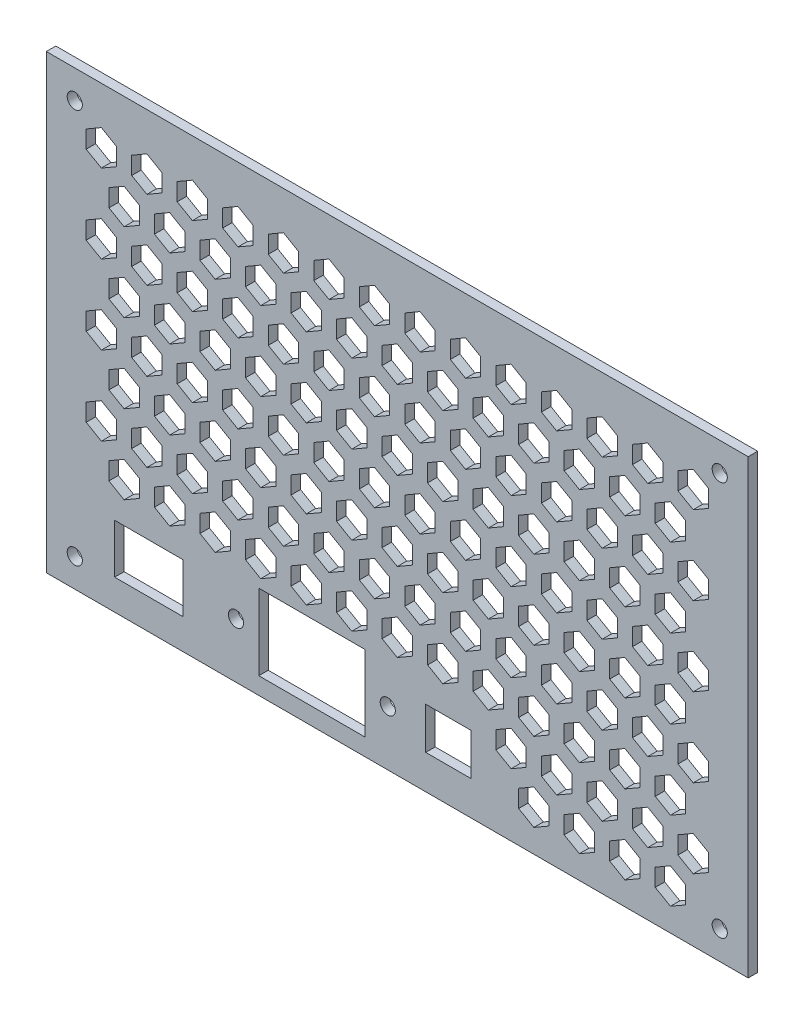
from build123d import *

# Parameters (mm, degrees)
SKETCH1_W               = 185
SKETCH1_H               = 115
BOSS_EXTRUDE1_DEPTH     = 2.5
SKETCH2_R               = 2
SKETCH2_W               = 18
SKETCH2_H               = 13
SKETCH2_W_2             = 28
SKETCH2_H_2             = 20
CUT_EXTRUDE1_DEPTH      = 10
CUT_EXTRUDE3_DEPTH      = 10
CUT_EXTRUDE4_DEPTH      = 109.943792848
CUT_EXTRUDE4_DEPTH_BACK = 109.943792848
SKETCH6_R               = 2
SKETCH8_W               = 12
SKETCH8_H               = 11
CUT_EXTRUDE5_DEPTH      = 10
SKETCH9_W               = 185
SKETCH9_H               = 4
BOSS_EXTRUDE2_DEPTH     = 2.5


with BuildPart() as part:
    # Sketch1 → Boss-Extrude1 (new body)
    with BuildSketch(Plane.XY):
        Rectangle(SKETCH1_W, SKETCH1_H)
    extrude(amount=BOSS_EXTRUDE1_DEPTH)

    # Sketch2 → Cut-Extrude1 (cut)
    with BuildSketch(Plane(origin=(0, 0, 0), x_dir=(-1, 0, 0), z_dir=(0, 0, -1))):
        with Locations((42.5, -43)):
            Circle(SKETCH2_R)
        with Locations((2.5, -43)):
            Circle(SKETCH2_R)
        with Locations((65.5, -43)):
            Rectangle(SKETCH2_W, SKETCH2_H)
        with Locations((22.5, -43)):
            Rectangle(SKETCH2_W_2, SKETCH2_H_2)
    extrude(amount=-CUT_EXTRUDE1_DEPTH, mode=Mode.SUBTRACT)

    # Sketch5 → Cut-Extrude3 (cut)
    with BuildSketch(Plane(origin=(0, 0, 0), x_dir=(-1, 0, 0), z_dir=(0, 0, -1))):
        Polygon((-72, 40.982695155), (-76, 38.673294078), (-76, 34.054491924), (-72, 31.745090848), (-68, 34.054491924), (-68, 38.673294078), align=None)
        Polygon((-78, 51.375), (-82, 49.065598923), (-82, 44.44679677), (-78, 42.137395693), (-74, 44.44679677), (-74, 49.065598923), align=None)
        Polygon((-60, 40.982695155), (-64, 38.673294078), (-64, 34.054491924), (-60, 31.745090848), (-56, 34.054491924), (-56, 38.673294078), align=None)
        Polygon((-66, 51.375), (-70, 49.065598923), (-70, 44.44679677), (-66, 42.137395693), (-62, 44.44679677), (-62, 49.065598923), align=None)
        Polygon((-48, 40.982695155), (-52, 38.673294078), (-52, 34.054491924), (-48, 31.745090848), (-44, 34.054491924), (-44, 38.673294078), align=None)
        Polygon((-54, 51.375), (-58, 49.065598923), (-58, 44.44679677), (-54, 42.137395693), (-50, 44.44679677), (-50, 49.065598923), align=None)
        Polygon((-36, 40.982695155), (-40, 38.673294078), (-40, 34.054491924), (-36, 31.745090848), (-32, 34.054491924), (-32, 38.673294078), align=None)
        Polygon((-42, 51.375), (-46, 49.065598923), (-46, 44.44679677), (-42, 42.137395693), (-38, 44.44679677), (-38, 49.065598923), align=None)
        Polygon((-24, 40.982695155), (-28, 38.673294078), (-28, 34.054491924), (-24, 31.745090848), (-20, 34.054491924), (-20, 38.673294078), align=None)
        Polygon((-30, 51.375), (-34, 49.065598923), (-34, 44.44679677), (-30, 42.137395693), (-26, 44.44679677), (-26, 49.065598923), align=None)
        Polygon((-12, 40.982695155), (-16, 38.673294078), (-16, 34.054491924), (-12, 31.745090848), (-8, 34.054491924), (-8, 38.673294078), align=None)
        Polygon((-18, 51.375), (-22, 49.065598923), (-22, 44.44679677), (-18, 42.137395693), (-14, 44.44679677), (-14, 49.065598923), align=None)
        Polygon((0, 40.982695155), (-4, 38.673294078), (-4, 34.054491924), (0, 31.745090848), (4, 34.054491924), (4, 38.673294078), align=None)
        Polygon((-6, 51.375), (-10, 49.065598923), (-10, 44.44679677), (-6, 42.137395693), (-2, 44.44679677), (-2, 49.065598923), align=None)
        Polygon((12, 40.982695155), (8, 38.673294078), (8, 34.054491924), (12, 31.745090848), (16, 34.054491924), (16, 38.673294078), align=None)
        Polygon((6, 51.375), (2, 49.065598923), (2, 44.44679677), (6, 42.137395693), (10, 44.44679677), (10, 49.065598923), align=None)
        Polygon((24, 40.982695155), (20, 38.673294078), (20, 34.054491924), (24, 31.745090848), (28, 34.054491924), (28, 38.673294078), align=None)
        Polygon((18, 51.375), (14, 49.065598923), (14, 44.44679677), (18, 42.137395693), (22, 44.44679677), (22, 49.065598923), align=None)
        Polygon((36, 40.982695155), (32, 38.673294078), (32, 34.054491924), (36, 31.745090848), (40, 34.054491924), (40, 38.673294078), align=None)
        Polygon((30, 51.375), (26, 49.065598923), (26, 44.44679677), (30, 42.137395693), (34, 44.44679677), (34, 49.065598923), align=None)
        Polygon((48, 40.982695155), (44, 38.673294078), (44, 34.054491924), (48, 31.745090848), (52, 34.054491924), (52, 38.673294078), align=None)
        Polygon((42, 51.375), (38, 49.065598923), (38, 44.44679677), (42, 42.137395693), (46, 44.44679677), (46, 49.065598923), align=None)
        Polygon((60, 40.982695155), (56, 38.673294078), (56, 34.054491924), (60, 31.745090848), (64, 34.054491924), (64, 38.673294078), align=None)
        Polygon((54, 51.375), (50, 49.065598923), (50, 44.44679677), (54, 42.137395693), (58, 44.44679677), (58, 49.065598923), align=None)
        Polygon((72, 40.982695155), (68, 38.673294078), (68, 34.054491924), (72, 31.745090848), (76, 34.054491924), (76, 38.673294078), align=None)
        Polygon((66, 51.375), (62, 49.065598923), (62, 44.44679677), (66, 42.137395693), (70, 44.44679677), (70, 49.065598923), align=None)
        Polygon((-60, 20.202695155), (-64, 17.893294078), (-64, 13.274491924), (-60, 10.965090848), (-56, 13.274491924), (-56, 17.893294078), align=None)
        Polygon((-66, 30.595), (-70, 28.285598923), (-70, 23.66679677), (-66, 21.357395693), (-62, 23.66679677), (-62, 28.285598923), align=None)
        Polygon((-48, 20.202695155), (-52, 17.893294078), (-52, 13.274491924), (-48, 10.965090848), (-44, 13.274491924), (-44, 17.893294078), align=None)
        Polygon((-54, 30.595), (-58, 28.285598923), (-58, 23.66679677), (-54, 21.357395693), (-50, 23.66679677), (-50, 28.285598923), align=None)
        Polygon((-36, 20.202695155), (-40, 17.893294078), (-40, 13.274491924), (-36, 10.965090848), (-32, 13.274491924), (-32, 17.893294078), align=None)
        Polygon((-42, 30.595), (-46, 28.285598923), (-46, 23.66679677), (-42, 21.357395693), (-38, 23.66679677), (-38, 28.285598923), align=None)
        Polygon((-24, 20.202695155), (-28, 17.893294078), (-28, 13.274491924), (-24, 10.965090848), (-20, 13.274491924), (-20, 17.893294078), align=None)
        Polygon((-30, 30.595), (-34, 28.285598923), (-34, 23.66679677), (-30, 21.357395693), (-26, 23.66679677), (-26, 28.285598923), align=None)
        Polygon((-12, 20.202695155), (-16, 17.893294078), (-16, 13.274491924), (-12, 10.965090848), (-8, 13.274491924), (-8, 17.893294078), align=None)
        Polygon((-18, 30.595), (-22, 28.285598923), (-22, 23.66679677), (-18, 21.357395693), (-14, 23.66679677), (-14, 28.285598923), align=None)
        Polygon((0, 20.202695155), (-4, 17.893294078), (-4, 13.274491924), (0, 10.965090848), (4, 13.274491924), (4, 17.893294078), align=None)
        Polygon((-6, 30.595), (-10, 28.285598923), (-10, 23.66679677), (-6, 21.357395693), (-2, 23.66679677), (-2, 28.285598923), align=None)
        Polygon((12, 20.202695155), (8, 17.893294078), (8, 13.274491924), (12, 10.965090848), (16, 13.274491924), (16, 17.893294078), align=None)
        Polygon((6, 30.595), (2, 28.285598923), (2, 23.66679677), (6, 21.357395693), (10, 23.66679677), (10, 28.285598923), align=None)
        Polygon((24, 20.202695155), (20, 17.893294078), (20, 13.274491924), (24, 10.965090848), (28, 13.274491924), (28, 17.893294078), align=None)
        Polygon((18, 30.595), (14, 28.285598923), (14, 23.66679677), (18, 21.357395693), (22, 23.66679677), (22, 28.285598923), align=None)
        Polygon((36, 20.202695155), (32, 17.893294078), (32, 13.274491924), (36, 10.965090848), (40, 13.274491924), (40, 17.893294078), align=None)
        Polygon((30, 30.595), (26, 28.285598923), (26, 23.66679677), (30, 21.357395693), (34, 23.66679677), (34, 28.285598923), align=None)
        Polygon((48, 20.202695155), (44, 17.893294078), (44, 13.274491924), (48, 10.965090848), (52, 13.274491924), (52, 17.893294078), align=None)
        Polygon((42, 30.595), (38, 28.285598923), (38, 23.66679677), (42, 21.357395693), (46, 23.66679677), (46, 28.285598923), align=None)
        Polygon((60, 20.202695155), (56, 17.893294078), (56, 13.274491924), (60, 10.965090848), (64, 13.274491924), (64, 17.893294078), align=None)
        Polygon((54, 30.595), (50, 28.285598923), (50, 23.66679677), (54, 21.357395693), (58, 23.66679677), (58, 28.285598923), align=None)
        Polygon((72, 20.202695155), (68, 17.893294078), (68, 13.274491924), (72, 10.965090848), (76, 13.274491924), (76, 17.893294078), align=None)
        Polygon((66, 30.595), (62, 28.285598923), (62, 23.66679677), (66, 21.357395693), (70, 23.66679677), (70, 28.285598923), align=None)
        Polygon((-60, -0.577304845), (-64, -2.886705922), (-64, -7.505508076), (-60, -9.814909152), (-56, -7.505508076), (-56, -2.886705922), align=None)
        Polygon((-66, 9.815), (-70, 7.505598923), (-70, 2.88679677), (-66, 0.577395693), (-62, 2.88679677), (-62, 7.505598923), align=None)
        Polygon((-48, -0.577304845), (-52, -2.886705922), (-52, -7.505508076), (-48, -9.814909152), (-44, -7.505508076), (-44, -2.886705922), align=None)
        Polygon((-54, 9.815), (-58, 7.505598923), (-58, 2.88679677), (-54, 0.577395693), (-50, 2.88679677), (-50, 7.505598923), align=None)
        Polygon((-36, -0.577304845), (-40, -2.886705922), (-40, -7.505508076), (-36, -9.814909152), (-32, -7.505508076), (-32, -2.886705922), align=None)
        Polygon((-42, 9.815), (-46, 7.505598923), (-46, 2.88679677), (-42, 0.577395693), (-38, 2.88679677), (-38, 7.505598923), align=None)
        Polygon((-24, -0.577304845), (-28, -2.886705922), (-28, -7.505508076), (-24, -9.814909152), (-20, -7.505508076), (-20, -2.886705922), align=None)
        Polygon((-30, 9.815), (-34, 7.505598923), (-34, 2.88679677), (-30, 0.577395693), (-26, 2.88679677), (-26, 7.505598923), align=None)
        Polygon((-12, -0.577304845), (-16, -2.886705922), (-16, -7.505508076), (-12, -9.814909152), (-8, -7.505508076), (-8, -2.886705922), align=None)
        Polygon((-18, 9.815), (-22, 7.505598923), (-22, 2.88679677), (-18, 0.577395693), (-14, 2.88679677), (-14, 7.505598923), align=None)
        Polygon((0, -0.577304845), (-4, -2.886705922), (-4, -7.505508076), (0, -9.814909152), (4, -7.505508076), (4, -2.886705922), align=None)
        Polygon((-6, 9.815), (-10, 7.505598923), (-10, 2.88679677), (-6, 0.577395693), (-2, 2.88679677), (-2, 7.505598923), align=None)
        Polygon((12, -0.577304845), (8, -2.886705922), (8, -7.505508076), (12, -9.814909152), (16, -7.505508076), (16, -2.886705922), align=None)
        Polygon((6, 9.815), (2, 7.505598923), (2, 2.88679677), (6, 0.577395693), (10, 2.88679677), (10, 7.505598923), align=None)
        Polygon((24, -0.577304845), (20, -2.886705922), (20, -7.505508076), (24, -9.814909152), (28, -7.505508076), (28, -2.886705922), align=None)
        Polygon((18, 9.815), (14, 7.505598923), (14, 2.88679677), (18, 0.577395693), (22, 2.88679677), (22, 7.505598923), align=None)
        Polygon((36, -0.577304845), (32, -2.886705922), (32, -7.505508076), (36, -9.814909152), (40, -7.505508076), (40, -2.886705922), align=None)
        Polygon((30, 9.815), (26, 7.505598923), (26, 2.88679677), (30, 0.577395693), (34, 2.88679677), (34, 7.505598923), align=None)
        Polygon((48, -0.577304845), (44, -2.886705922), (44, -7.505508076), (48, -9.814909152), (52, -7.505508076), (52, -2.886705922), align=None)
        Polygon((42, 9.815), (38, 7.505598923), (38, 2.88679677), (42, 0.577395693), (46, 2.88679677), (46, 7.505598923), align=None)
        Polygon((60, -0.577304845), (56, -2.886705922), (56, -7.505508076), (60, -9.814909152), (64, -7.505508076), (64, -2.886705922), align=None)
        Polygon((54, 9.815), (50, 7.505598923), (50, 2.88679677), (54, 0.577395693), (58, 2.88679677), (58, 7.505598923), align=None)
        Polygon((72, -0.577304845), (68, -2.886705922), (68, -7.505508076), (72, -9.814909152), (76, -7.505508076), (76, -2.886705922), align=None)
        Polygon((66, 9.815), (62, 7.505598923), (62, 2.88679677), (66, 0.577395693), (70, 2.88679677), (70, 7.505598923), align=None)
        Polygon((-72, 20.202695155), (-76, 17.893294078), (-76, 13.274491924), (-72, 10.965090848), (-68, 13.274491924), (-68, 17.893294078), align=None)
        Polygon((-78, 30.595), (-82, 28.285598923), (-82, 23.66679677), (-78, 21.357395693), (-74, 23.66679677), (-74, 28.285598923), align=None)
        Polygon((-72, -0.577304845), (-76, -2.886705922), (-76, -7.505508076), (-72, -9.814909152), (-68, -7.505508076), (-68, -2.886705922), align=None)
        Polygon((-78, 9.815), (-82, 7.505598923), (-82, 2.88679677), (-78, 0.577395693), (-74, 2.88679677), (-74, 7.505598923), align=None)
        Polygon((-72, -21.357304845), (-76, -23.666705922), (-76, -28.285508076), (-72, -30.594909152), (-68, -28.285508076), (-68, -23.666705922), align=None)
        Polygon((78, 51.375), (74, 49.065598923), (74, 44.44679677), (78, 42.137395693), (82, 44.44679677), (82, 49.065598923), align=None)
        Polygon((-78, -10.965), (-82, -13.274401077), (-82, -17.89320323), (-78, -20.202604307), (-74, -17.89320323), (-74, -13.274401077), align=None)
        Polygon((-60, -21.357304845), (-64, -23.666705922), (-64, -28.285508076), (-60, -30.594909152), (-56, -28.285508076), (-56, -23.666705922), align=None)
        Polygon((-66, -10.965), (-70, -13.274401077), (-70, -17.89320323), (-66, -20.202604307), (-62, -17.89320323), (-62, -13.274401077), align=None)
        Polygon((-48, -21.357304845), (-52, -23.666705922), (-52, -28.285508076), (-48, -30.594909152), (-44, -28.285508076), (-44, -23.666705922), align=None)
        Polygon((-54, -10.965), (-58, -13.274401077), (-58, -17.89320323), (-54, -20.202604307), (-50, -17.89320323), (-50, -13.274401077), align=None)
        Polygon((-36, -21.357304845), (-40, -23.666705922), (-40, -28.285508076), (-36, -30.594909152), (-32, -28.285508076), (-32, -23.666705922), align=None)
        Polygon((-42, -10.965), (-46, -13.274401077), (-46, -17.89320323), (-42, -20.202604307), (-38, -17.89320323), (-38, -13.274401077), align=None)
        Polygon((-24, -21.357304845), (-28, -23.666705922), (-28, -28.285508076), (-24, -30.594909152), (-20, -28.285508076), (-20, -23.666705922), align=None)
        Polygon((-30, -10.965), (-34, -13.274401077), (-34, -17.89320323), (-30, -20.202604307), (-26, -17.89320323), (-26, -13.274401077), align=None)
        Polygon((-12, -21.357304845), (-16, -23.666705922), (-16, -28.285508076), (-12, -30.594909152), (-8, -28.285508076), (-8, -23.666705922), align=None)
        Polygon((-18, -10.965), (-22, -13.274401077), (-22, -17.89320323), (-18, -20.202604307), (-14, -17.89320323), (-14, -13.274401077), align=None)
        Polygon((0, -21.357304845), (-4, -23.666705922), (-4, -28.285508076), (0, -30.594909152), (4, -28.285508076), (4, -23.666705922), align=None)
        Polygon((-6, -10.965), (-10, -13.274401077), (-10, -17.89320323), (-6, -20.202604307), (-2, -17.89320323), (-2, -13.274401077), align=None)
        Polygon((12, -21.357304845), (8, -23.666705922), (8, -28.285508076), (12, -30.594909152), (16, -28.285508076), (16, -23.666705922), align=None)
        Polygon((6, -10.965), (2, -13.274401077), (2, -17.89320323), (6, -20.202604307), (10, -17.89320323), (10, -13.274401077), align=None)
        Polygon((24, -21.357304845), (20, -23.666705922), (20, -28.285508076), (24, -30.594909152), (28, -28.285508076), (28, -23.666705922), align=None)
        Polygon((18, -10.965), (14, -13.274401077), (14, -17.89320323), (18, -20.202604307), (22, -17.89320323), (22, -13.274401077), align=None)
        Polygon((36, -21.357304845), (32, -23.666705922), (32, -28.285508076), (36, -30.594909152), (40, -28.285508076), (40, -23.666705922), align=None)
        Polygon((30, -10.965), (26, -13.274401077), (26, -17.89320323), (30, -20.202604307), (34, -17.89320323), (34, -13.274401077), align=None)
        Polygon((48, -21.357304845), (44, -23.666705922), (44, -28.285508076), (48, -30.594909152), (52, -28.285508076), (52, -23.666705922), align=None)
        Polygon((42, -10.965), (38, -13.274401077), (38, -17.89320323), (42, -20.202604307), (46, -17.89320323), (46, -13.274401077), align=None)
        Polygon((60, -21.357304845), (56, -23.666705922), (56, -28.285508076), (60, -30.594909152), (64, -28.285508076), (64, -23.666705922), align=None)
        Polygon((54, -10.965), (50, -13.274401077), (50, -17.89320323), (54, -20.202604307), (58, -17.89320323), (58, -13.274401077), align=None)
        Polygon((72, -21.357304845), (68, -23.666705922), (68, -28.285508076), (72, -30.594909152), (76, -28.285508076), (76, -23.666705922), align=None)
        Polygon((66, -10.965), (62, -13.274401077), (62, -17.89320323), (66, -20.202604307), (70, -17.89320323), (70, -13.274401077), align=None)
        Polygon((78, 30.595), (74, 28.285598923), (74, 23.66679677), (78, 21.357395693), (82, 23.66679677), (82, 28.285598923), align=None)
        Polygon((78, 9.815), (74, 7.505598923), (74, 2.88679677), (78, 0.577395693), (82, 2.88679677), (82, 7.505598923), align=None)
        Polygon((78, -10.965), (74, -13.274401077), (74, -17.89320323), (78, -20.202604307), (82, -17.89320323), (82, -13.274401077), align=None)
        Polygon((-72, -42.137304845), (-76, -44.446705922), (-76, -49.065508076), (-72, -51.374909152), (-68, -49.065508076), (-68, -44.446705922), align=None)
        Polygon((-78, -31.745), (-82, -34.054401077), (-82, -38.67320323), (-78, -40.982604307), (-74, -38.67320323), (-74, -34.054401077), align=None)
        Polygon((-60, -42.137304845), (-64, -44.446705922), (-64, -49.065508076), (-60, -51.374909152), (-56, -49.065508076), (-56, -44.446705922), align=None)
        Polygon((-66, -31.745), (-70, -34.054401077), (-70, -38.67320323), (-66, -40.982604307), (-62, -38.67320323), (-62, -34.054401077), align=None)
        Polygon((-48, -42.137304845), (-52, -44.446705922), (-52, -49.065508076), (-48, -51.374909152), (-44, -49.065508076), (-44, -44.446705922), align=None)
        Polygon((-54, -31.745), (-58, -34.054401077), (-58, -38.67320323), (-54, -40.982604307), (-50, -38.67320323), (-50, -34.054401077), align=None)
        Polygon((-36, -42.137304845), (-40, -44.446705922), (-40, -49.065508076), (-36, -51.374909152), (-32, -49.065508076), (-32, -44.446705922), align=None)
        Polygon((-42, -31.745), (-46, -34.054401077), (-46, -38.67320323), (-42, -40.982604307), (-38, -38.67320323), (-38, -34.054401077), align=None)
        Polygon((-30, -31.745), (-34, -34.054401077), (-34, -38.67320323), (-30, -40.982604307), (-26, -38.67320323), (-26, -34.054401077), align=None)
    extrude(amount=-CUT_EXTRUDE3_DEPTH, mode=Mode.SUBTRACT)

    # Sketch6 → Cut-Extrude4 (cut, two sides: drawn at the far end of the back side and taken through both)
    with BuildSketch(Plane(origin=(0, 0, 0), x_dir=(-1, 0, 0), z_dir=(0, 0, -1)).offset(-CUT_EXTRUDE4_DEPTH_BACK)):
        with Locations((-85, 54)):
            Circle(SKETCH6_R)
        with Locations((85, 54)):
            Circle(SKETCH6_R)
        with Locations((85, -50)):
            Circle(SKETCH6_R)
        with Locations((-85, -50)):
            Circle(SKETCH6_R)
    extrude(amount=CUT_EXTRUDE4_DEPTH + CUT_EXTRUDE4_DEPTH_BACK, mode=Mode.SUBTRACT)

    # Sketch8 → Cut-Extrude5 (cut)
    with BuildSketch(Plane(origin=(0, 0, 0), x_dir=(-1, 0, 0), z_dir=(0, 0, -1))):
        with Locations((-13.5, -43)):
            Rectangle(SKETCH8_W, SKETCH8_H)
    extrude(amount=-CUT_EXTRUDE5_DEPTH, mode=Mode.SUBTRACT)

    # Sketch9 → Boss-Extrude2 (add)
    with BuildSketch(Plane(origin=(0, 0, 0), x_dir=(-1, 0, 0), z_dir=(0, 0, -1))):
        with Locations((0, 59.5)):
            Rectangle(SKETCH9_W, SKETCH9_H)
    extrude(amount=-BOSS_EXTRUDE2_DEPTH)


solid = part.part
